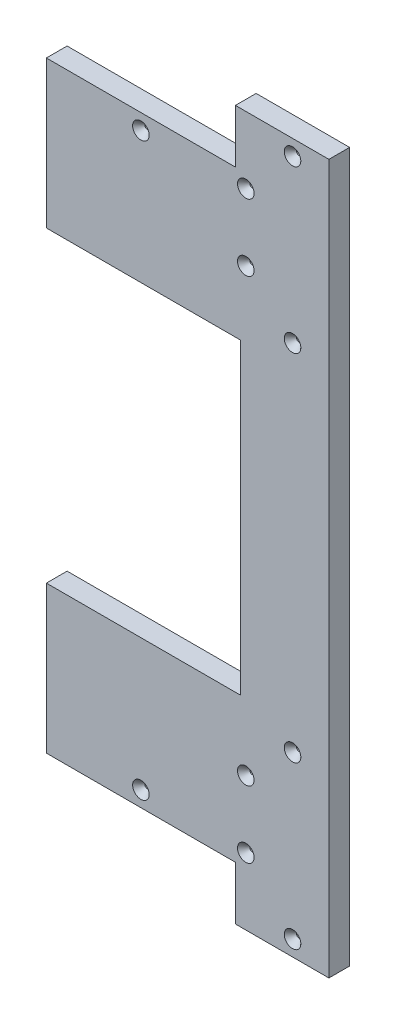
from build123d import *

# Parameters (mm, degrees)
SKETCH1_W           = 198.582793441
SKETCH1_H           = 434.599999988
BOSS_EXTRUDE1_DEPTH = 12.7
CUT_EXTRUDE1_REACH  = 248.995
SKETCH2_W           = 141.287862113
SKETCH2_H           = 32.775
CUT_EXTRUDE2_REACH  = 248.995
HOLE1_D             = 3.175
HOLE1_DEPTH         = 38.1
HOLE1_CSINK_D       = 10.16
HOLE1_CSINK_ANGLE   = 82
HOLE1_TIP           = 0.953866233


with BuildPart() as part:
    # Sketch1 → Boss-Extrude1 (new body)
    with BuildSketch(Plane.XY):
        with Locations((17.439596016, 0)):
            Rectangle(SKETCH1_W, SKETCH1_H)
    extrude(amount=BOSS_EXTRUDE1_DEPTH)

    # Sketch2 → Cut-Extrude1 (cut, up to next)
    with BuildSketch(Plane(origin=(0, 0, 0), x_dir=(-1, 0, 0), z_dir=(0, 0, -1)), mode=Mode.PRIVATE) as cut_extrude1_sk1:
        with Locations((11.207869649, 200.912499994)):
            Rectangle(SKETCH2_W, SKETCH2_H)
    cut_extrude1_tool1 = extrude(cut_extrude1_sk1.sketch, amount=-CUT_EXTRUDE1_REACH, mode=Mode.PRIVATE) & part.part
    # Sketch2 → Cut-Extrude1 (cut, up to next)
    with BuildSketch(Plane(origin=(0, 0, 0), x_dir=(-1, 0, 0), z_dir=(0, 0, -1)), mode=Mode.PRIVATE) as cut_extrude1_sk2:
        with Locations((11.207869649, -200.912499994)):
            Rectangle(SKETCH2_W, SKETCH2_H)
    cut_extrude1_tool2 = extrude(cut_extrude1_sk2.sketch, amount=-CUT_EXTRUDE1_REACH, mode=Mode.PRIVATE) & part.part
    add(cut_extrude1_tool1.solids().sort_by_distance((-11.20787, 200.9125, 0))[0], mode=Mode.SUBTRACT)
    add(cut_extrude1_tool2.solids().sort_by_distance((-11.20787, -200.9125, 0))[0], mode=Mode.SUBTRACT)

    # Sketch3 → Cut-Extrude2 (cut, up to next)
    with BuildSketch(Plane.XY.offset(12.7), mode=Mode.PRIVATE) as cut_extrude2_sk1:
        Polygon((62.611061408, 94.249999997), (-56.451800705, 94.249999997), (-56.451800705, 184.524999994), (-81.851800705, 184.524999994), (-81.851800705, 94.249999997), (-85.026800705, 94.249999997), (-85.026800705, -94.249999997), (-81.851800705, -94.249999997), (-81.851800705, -184.524999994), (-56.451800705, -184.524999994), (-56.451800705, -94.249999997), (62.611061408, -94.249999997), align=None)
    cut_extrude2_tool1 = extrude(cut_extrude2_sk1.sketch, amount=-CUT_EXTRUDE2_REACH, mode=Mode.PRIVATE) & part.part
    add(cut_extrude2_tool1.solids().sort_by_distance((-19.405412, 0, 12.7))[0], mode=Mode.SUBTRACT)

    # Hole1
    with Locations(Plane(origin=(449.828463103, 0, 12.7), x_dir=(0, 1, 0), z_dir=(0, 0, 1))):
        with Locations((-108.649999997, 355.39493603), (108.649999997, 355.39493603), (207.774999994, 355.39493603), (174.999999994, 448.336332751), (135.266666663, 384.042401694), (176.283333328, 384.042401694), (-174.999999994, 448.336332751), (-135.266666663, 384.042401694), (-176.283333328, 384.042401694), (-207.774999994, 355.39493603)):
            CounterSinkHole(HOLE1_D / 2, HOLE1_CSINK_D / 2, depth=HOLE1_DEPTH, counter_sink_angle=HOLE1_CSINK_ANGLE)
            with Locations((0, 0, -(HOLE1_DEPTH + HOLE1_TIP / 2))):  # 118° drill point
                Cone(0, HOLE1_D / 2, HOLE1_TIP, mode=Mode.SUBTRACT)


solid = part.part
